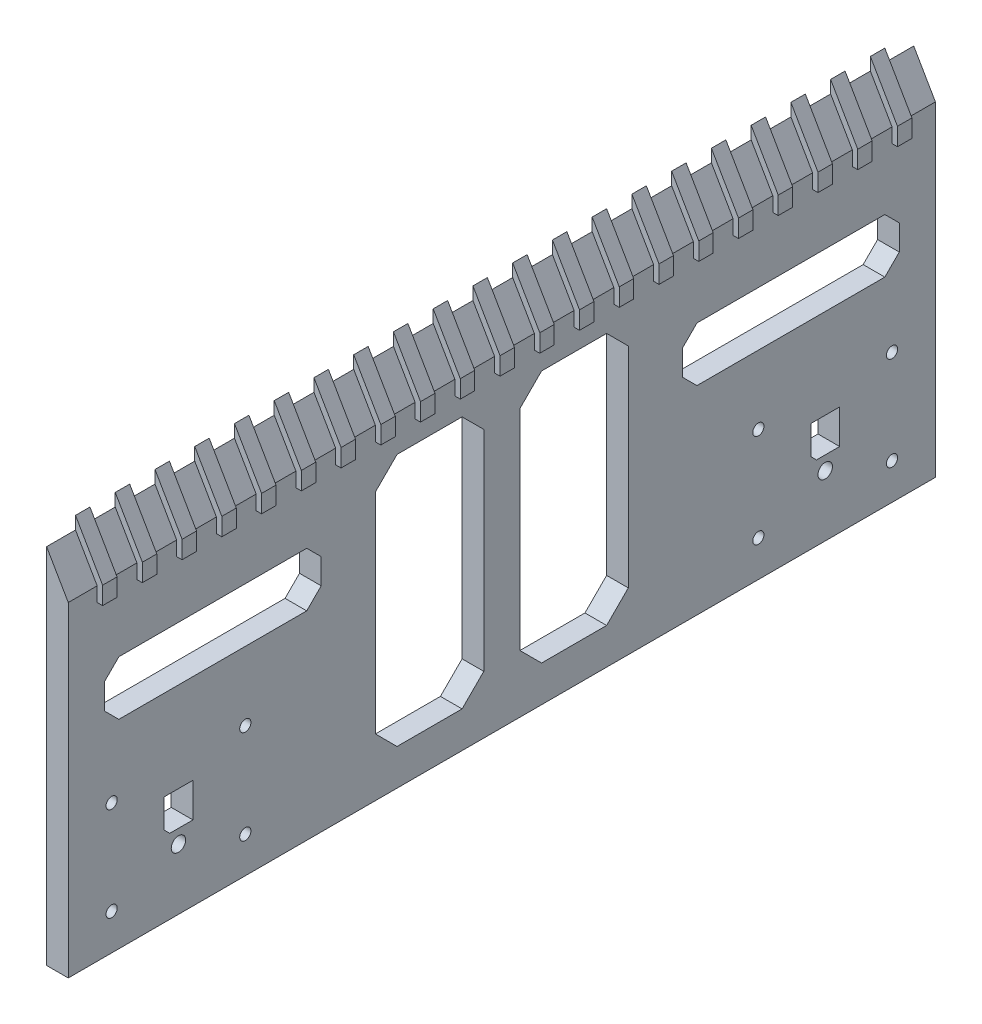
from build123d import *

# Parameters (mm, degrees)
SKETCH_1_W                  = 240
SKETCH_1_H                  = 90
EXTRUDE_1_DEPTH             = 6
SKETCH_2_R                  = 1.55
CUT_EXTRUDE_1_DEPTH         = 257.390327431
SKETCH_3_W                  = 60
SKETCH_3_H                  = 15
CUT_EXTRUDE_2_DEPTH         = 257.390327431
SKETCH_4_W                  = 30
SKETCH_4_H                  = 70
CUT_EXTRUDE_3_DEPTH         = 257.390327431
SKETCH_5_R                  = 3
CUT_EXTRUDE_4_DEPTH         = 3
EXTRUDE_2_DEPTH             = 240
CHAMFER_1_SIZE              = 4
CHAMFER_2_SIZE              = 6
EXTRUDE_3_DEPTH             = 2
PATTERN_LINEAR_1_COUNT      = 11
PATTERN_LINEAR_1_PITCH      = 11
PATTERN_LINEAR_1_COUNT_DIR2 = 11
PATTERN_LINEAR_1_PITCH_DIR2 = 11
CUT_EXTRUDE_5_DEPTH         = 6
SKETCH_10_R                 = 2
CUT_EXTRUDE_6_DEPTH         = 7


with BuildPart() as part:
    # 草图1 → 凸台-拉伸1 (new body)
    with BuildSketch(Plane(origin=(0, 0, 0), x_dir=(0, 0, -1), z_dir=(1, 0, 0))):
        with Locations((120, -45)):
            Rectangle(SKETCH_1_W, SKETCH_1_H)
    extrude(amount=EXTRUDE_1_DEPTH)

    # 草图2 → 切除-拉伸1 (cut, through all)
    with BuildSketch(Plane(origin=(6, 0, 0), x_dir=(0, 0, -1), z_dir=(1, 0, 0))):
        with Locations((12, -54)):
            Circle(SKETCH_2_R)
        with Locations((49, -80)):
            Circle(SKETCH_2_R)
        with Locations((49, -54)):
            Circle(SKETCH_2_R)
        with Locations((12, -80)):
            Circle(SKETCH_2_R)
        with Locations((228, -80)):
            Circle(SKETCH_2_R)
        with Locations((191, -54)):
            Circle(SKETCH_2_R)
        with Locations((191, -80)):
            Circle(SKETCH_2_R)
        with Locations((228, -54)):
            Circle(SKETCH_2_R)
    extrude(amount=-CUT_EXTRUDE_1_DEPTH, mode=Mode.SUBTRACT)

    # 草图3 → 切除-拉伸2 (cut, through all)
    with BuildSketch(Plane(origin=(6, 0, 0), x_dir=(0, 0, -1), z_dir=(1, 0, 0))):
        with Locations((40, -27.5)):
            Rectangle(SKETCH_3_W, SKETCH_3_H)
        with Locations((200, -27.5)):
            Rectangle(SKETCH_3_W, SKETCH_3_H)
    extrude(amount=-CUT_EXTRUDE_2_DEPTH, mode=Mode.SUBTRACT)

    # 草图4 → 切除-拉伸3 (cut, through all)
    with BuildSketch(Plane(origin=(6, 0, 0), x_dir=(0, 0, -1), z_dir=(1, 0, 0))):
        with Locations((100, -45)):
            Rectangle(SKETCH_4_W, SKETCH_4_H)
        with Locations((140, -45)):
            Rectangle(SKETCH_4_W, SKETCH_4_H)
    extrude(amount=-CUT_EXTRUDE_3_DEPTH, mode=Mode.SUBTRACT)

    # 草图5 → 切除-拉伸4 (cut)
    with BuildSketch(Plane.ZY):
        with Locations((-191, -80)):
            Circle(SKETCH_5_R)
        with Locations((-228, -80)):
            Circle(SKETCH_5_R)
        with Locations((-191, -54)):
            Circle(SKETCH_5_R)
        with Locations((-228, -54)):
            Circle(SKETCH_5_R)
        with Locations((-49, -80)):
            Circle(SKETCH_5_R)
        with Locations((-12, -80)):
            Circle(SKETCH_5_R)
        with Locations((-12, -54)):
            Circle(SKETCH_5_R)
        with Locations((-49, -54)):
            Circle(SKETCH_5_R)
    extrude(amount=-CUT_EXTRUDE_4_DEPTH, mode=Mode.SUBTRACT)

    # 草图6 → 凸台-拉伸2 (add)
    with BuildSketch(Plane.XY):
        Polygon((6, 0), (0, 0), (0, 10.392304845), align=None)
    extrude(amount=-EXTRUDE_2_DEPTH)

    # 倒角1
    chamfer_1_edges = [part.edges().sort_by_distance(p)[0] for p in [
        (3, -35, -170),
        (3, -35, -230),
        (3, -20, -230),
        (3, -20, -170),
        (3, -35, -70),
        (3, -20, -70),
        (3, -35, -10),
        (3, -20, -10),
    ]]
    chamfer(chamfer_1_edges, length=CHAMFER_1_SIZE)

    # 倒角2
    chamfer_2_edges = [part.edges().sort_by_distance(p)[0] for p in [
        (3, -80, -125),
        (3, -10, -155),
        (3, -10, -125),
        (3, -80, -155),
        (3, -80, -115),
        (3, -80, -85),
        (3, -10, -115),
        (3, -10, -85),
    ]]
    chamfer(chamfer_2_edges, length=CHAMFER_2_SIZE)

    # 草图8 → 凸台-拉伸3 (add, symmetric)
    with BuildSketch(Plane.XY.offset(-120)):
        Polygon((0, 10.392304845), (0, 13.892304845), (7.5, 0.901923789), (7.5, -4), (6, -4), (6, 0), align=None)
    extrude_3 = extrude(amount=EXTRUDE_3_DEPTH, both=True)

    # 阵列(线性)1: Extrude 3 11 × 11
    with Locations(*[Vector(0, 0, 1) * (i * PATTERN_LINEAR_1_PITCH) + Vector(0, 0, -1) * (j * PATTERN_LINEAR_1_PITCH_DIR2) for i in range(PATTERN_LINEAR_1_COUNT) for j in range(PATTERN_LINEAR_1_COUNT_DIR2) if (i, j) != (0, 0)]):
        add(extrude_3)

    # 草图9 → 切除-拉伸5 (cut)
    with BuildSketch(Plane.ZY):
        Polygon((-26.5, -67.77), (-26.5, -59.86), (-34.5, -59.86), (-34.5, -69.36), (-28.09, -69.36), align=None)
        Polygon((-205.5, -59.86), (-205.5, -67.77), (-207.09, -69.36), (-213.5, -69.36), (-213.5, -59.86), align=None)
    extrude(amount=-CUT_EXTRUDE_5_DEPTH, mode=Mode.SUBTRACT)

    # 草图10 → 切除-拉伸6 (cut)
    with BuildSketch(Plane.ZY):
        with Locations((-30.5, -73.14)):
            Circle(SKETCH_10_R)
        with Locations((-209.5, -73.14)):
            Circle(SKETCH_10_R)
    extrude(amount=-CUT_EXTRUDE_6_DEPTH, mode=Mode.SUBTRACT)


solid = part.part
